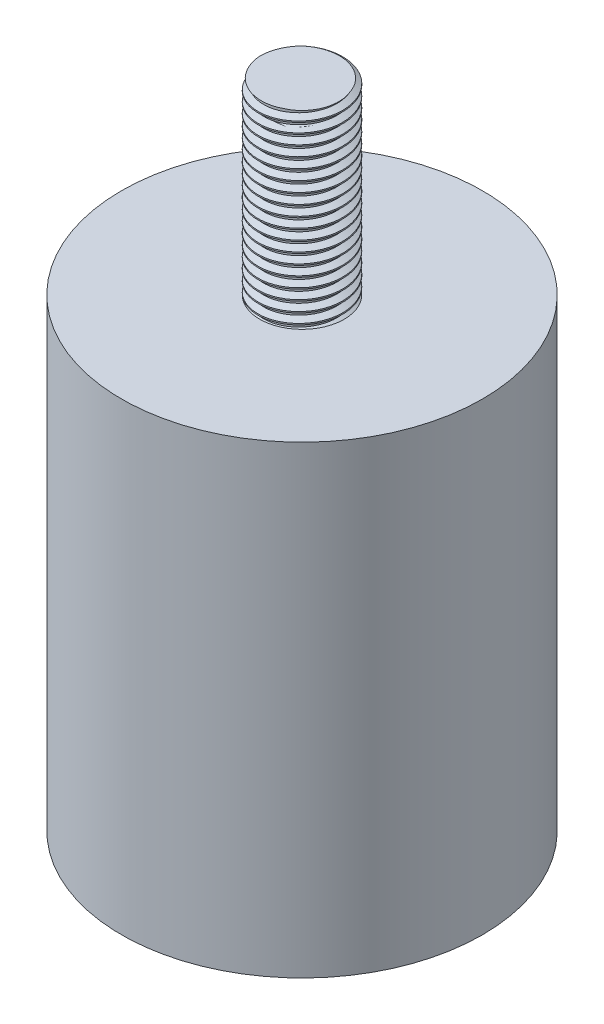
from build123d import *

# Parameters (mm, degrees)
SKETCH1_W             = 17.5
SKETCH1_H             = 45
SKETCH1_W_2           = 4.1
SKETCH1_H_2           = 18
THREAD1_PITCH         = 1
M8_TAPPED_HOLE1_D     = 6.8
M8_TAPPED_HOLE1_DEPTH = 15
M8_TAPPED_HOLE1_TIP   = 2.042926105


with BuildPart() as part:
    # Sketch1 → Revolve1 (revolve)
    with BuildSketch(Plane.XY):
        with Locations((-8.75, 0)):
            Rectangle(SKETCH1_W, SKETCH1_H)
        with Locations((-2.05, 31.5)):
            Rectangle(SKETCH1_W_2, SKETCH1_H_2)
    revolve(axis=Axis((0, 22.5, 0), (0, -1, 0)))

    # Thread1: the profile of Thread Profile1 profile screwed along a right-hand helix of 19 turns, 8 arcs to a turn; built about Z, then put on its axis
    thread1_z = Axis((0, 0, 0), (0, 0, 1))
    thread1_corners = [(4.1003, 0, -0.000173205), (4.1003, 0, 0.875173202), (3.558734125, 0, 0.562499999), (3.558734125, 0, 0.312499999)]
    with BuildLine(mode=Mode.PRIVATE) as thread1_profile:
        Line(thread1_corners[0], thread1_corners[1])
        Line(thread1_corners[1], thread1_corners[2])
        Line(thread1_corners[2], thread1_corners[3])
        Line(thread1_corners[3], thread1_corners[0])
    thread1_cap = Face(thread1_profile.wire())
    thread1_turn_angles = [0, 22.5, 45, 67.5, 90, 112.5, 135, 157.5, 180, 202.5, 225, 247.5, 270, 292.5, 315, 337.5, 360]
    thread1_turn_weights = [1, 0.9238795325112867, 1, 0.9238795325112867, 1, 0.9238795325112867, 1, 0.9238795325112867, 1, 0.9238795325112867, 1, 0.9238795325112867, 1, 0.9238795325112867, 1, 0.9238795325112867, 1]
    thread1_turn_rails = [Edge.make_bspline([Vector(p[0], p[1], 0).rotate(thread1_z, thread1_turn_angles[k]) / thread1_turn_weights[k] + Vector(0, 0, p[2] + THREAD1_PITCH * thread1_turn_angles[k] / 360) for k in range(17)], [0, 0, 0, 1, 1, 2, 2, 3, 3, 4, 4, 5, 5, 6, 6, 7, 7, 8, 8, 8], 2, thread1_turn_weights) for p in thread1_corners]
    thread1_turn_sides = [Face.make_surface_from_curves(thread1_turn_rails[p[0]], thread1_turn_rails[p[1]]) for p in [(0, 1), (1, 2), (2, 3), (3, 0)]]
    thread1 = Plane(origin=(0, 41.5, 0), x_dir=(-1, 0, 0), z_dir=(0, -1, 0)) * Solid(Shell([*[p.moved(Location((0, 0, THREAD1_PITCH * i))) for i in range(19) for p in thread1_turn_sides], thread1_cap, thread1_cap.rotate(thread1_z, 6840).moved(Location((0, 0, THREAD1_PITCH * 6840 / 360)))]))
    add(thread1, mode=Mode.SUBTRACT)

    # M8 Tapped Hole1
    with Locations(Plane(origin=(0, -22.5, 0), x_dir=(-1, 0, 0), z_dir=(0, -1, 0))):
        with Locations((0, 0)):
            Hole(M8_TAPPED_HOLE1_D / 2, depth=M8_TAPPED_HOLE1_DEPTH)
            with Locations((0, 0, -(M8_TAPPED_HOLE1_DEPTH + M8_TAPPED_HOLE1_TIP / 2))):  # 118° drill point
                Cone(0, M8_TAPPED_HOLE1_D / 2, M8_TAPPED_HOLE1_TIP, mode=Mode.SUBTRACT)


solid = part.part
